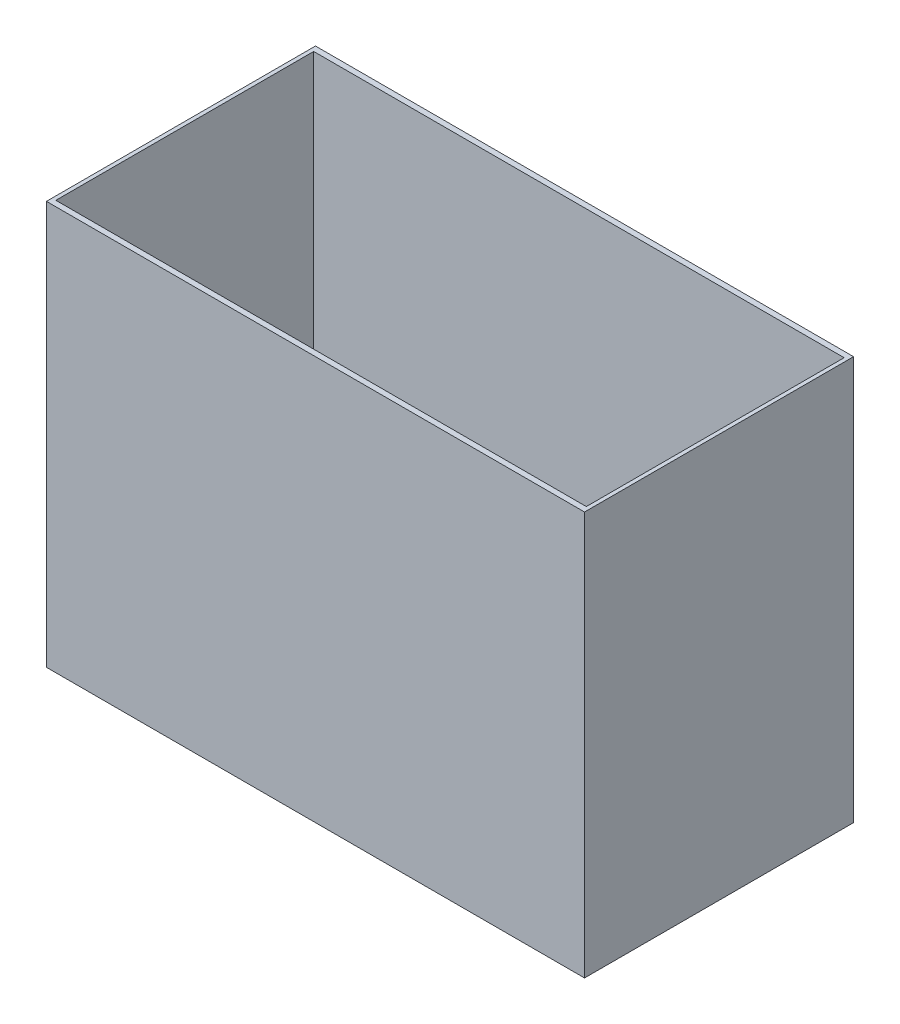
from build123d import *

# Parameters (mm, degrees)
SKETCH1_W           = 584.2
SKETCH1_H           = 279.4
BOSS_EXTRUDE1_DEPTH = 6.35
SKETCH3_W           = 609.6
SKETCH3_H           = 304.8
SKETCH3_W_2         = 600.964
SKETCH3_H_2         = 292.1
BOSS_EXTRUDE3_DEPTH = 457.2
SKETCH4_R           = 21.038100037
CUT_EXTRUDE1_DEPTH  = 566.15
SKETCH7_R           = 2.778125
CUT_EXTRUDE3_DEPTH  = 566.15
SKETCH8_R           = 1.984375
CUT_EXTRUDE4_DEPTH  = 566.15
SKETCH11_W          = 50.8
SKETCH11_H          = 3.175
CUT_EXTRUDE6_DEPTH  = 571.228585744
SKETCH12_W          = 6.35
SKETCH12_H          = 25.4
CUT_EXTRUDE7_DEPTH  = 566.15
SKETCH13_R          = 21.038100037
CUT_EXTRUDE8_DEPTH  = 566.15
SKETCH14_R          = 2.778125
CUT_EXTRUDE9_DEPTH  = 566.15


with BuildPart() as part:
    # Sketch1 → Boss-Extrude1 (new body)
    with BuildSketch(Plane(origin=(0, 0, 0), x_dir=(1, 0, 0), z_dir=(0, 1, 0))):
        Rectangle(SKETCH1_W, SKETCH1_H)
    extrude(amount=BOSS_EXTRUDE1_DEPTH)

    # Sketch4 → Cut-Extrude1 (cut, through all)
    with BuildSketch(Plane(origin=(0, 6.35, 0), x_dir=(1, 0, 0), z_dir=(0, 1, 0))):
        with Locations((252.011899963, 99.611899963)):
            Circle(SKETCH4_R)
    cut_extrude1 = extrude(amount=-CUT_EXTRUDE1_DEPTH, mode=Mode.SUBTRACT)

    # Sketch7 → Cut-Extrude3 (cut, through all)
    with BuildSketch(Plane(origin=(0, 6.35, 0), x_dir=(1, 0, 0), z_dir=(0, 1, 0))):
        with Locations((190.5, 0)):
            Circle(SKETCH7_R)
    extrude(amount=-CUT_EXTRUDE3_DEPTH, mode=Mode.SUBTRACT)

    # Sketch8 → Cut-Extrude4 (cut, through all)
    with BuildSketch(Plane(origin=(0, 6.35, 0), x_dir=(1, 0, 0), z_dir=(0, 1, 0))):
        with Locations((94.9, -12.8415)):
            Circle(SKETCH8_R)
        with Locations((146.1, -12.8415)):
            Circle(SKETCH8_R)
        with Locations((146.1, 12.8415)):
            Circle(SKETCH8_R)
        with Locations((94.9, 12.8415)):
            Circle(SKETCH8_R)
    extrude(amount=-CUT_EXTRUDE4_DEPTH, mode=Mode.SUBTRACT)

    # Sketch11 → Cut-Extrude6 (cut, through all)
    with BuildSketch(Plane.XZ):
        with Locations((190.5, 138.1125)):
            Rectangle(SKETCH11_W, SKETCH11_H)
    cut_extrude6 = extrude(amount=-CUT_EXTRUDE6_DEPTH, mode=Mode.SUBTRACT)

    # Mirror2: Cut-Extrude1, Cut-Extrude6 across plane
    add(cut_extrude1.mirror(Plane.XY), mode=Mode.SUBTRACT)
    add(cut_extrude6.mirror(Plane.XY), mode=Mode.SUBTRACT)

    # Sketch12 → Cut-Extrude7 (cut, through all)
    with BuildSketch(Plane(origin=(0, 6.35, 0), x_dir=(1, 0, 0), z_dir=(0, 1, 0))):
        with Locations((288.925, -30.48)):
            Rectangle(SKETCH12_W, SKETCH12_H)
        with Locations((288.925, -91.44)):
            Rectangle(SKETCH12_W, SKETCH12_H)
        with Locations((288.925, 91.44)):
            Rectangle(SKETCH12_W, SKETCH12_H)
        with Locations((288.925, 30.48)):
            Rectangle(SKETCH12_W, SKETCH12_H)
    extrude(amount=-CUT_EXTRUDE7_DEPTH, mode=Mode.SUBTRACT)

    # Sketch13 → Cut-Extrude8 (cut, through all)
    with BuildSketch(Plane(origin=(0, 6.35, 0), x_dir=(1, 0, 0), z_dir=(0, 1, 0))):
        with Locations((133.500264321, -46.186585501)):
            Circle(SKETCH13_R)
        with Locations((210.617612829, 12.193993268)):
            Circle(SKETCH13_R)
    extrude(amount=-CUT_EXTRUDE8_DEPTH, mode=Mode.SUBTRACT)

    # Sketch14 → Cut-Extrude9 (cut, through all)
    with BuildSketch(Plane(origin=(0, 6.35, 0), x_dir=(1, 0, 0), z_dir=(0, 1, 0))):
        with Locations((45.303543088, 4.218995635)):
            Circle(SKETCH14_R)
    extrude(amount=-CUT_EXTRUDE9_DEPTH, mode=Mode.SUBTRACT)


with BuildPart() as body_2:
    # Sketch3 → Boss-Extrude3 (new body)
    with BuildSketch(Plane(origin=(0, 0, 0), x_dir=(1, 0, 0), z_dir=(0, 1, 0))):
        Rectangle(SKETCH3_W, SKETCH3_H)
        Rectangle(SKETCH3_W_2, SKETCH3_H_2, mode=Mode.SUBTRACT)
    extrude(amount=BOSS_EXTRUDE3_DEPTH)


solid = Compound([part.part, body_2.part])
